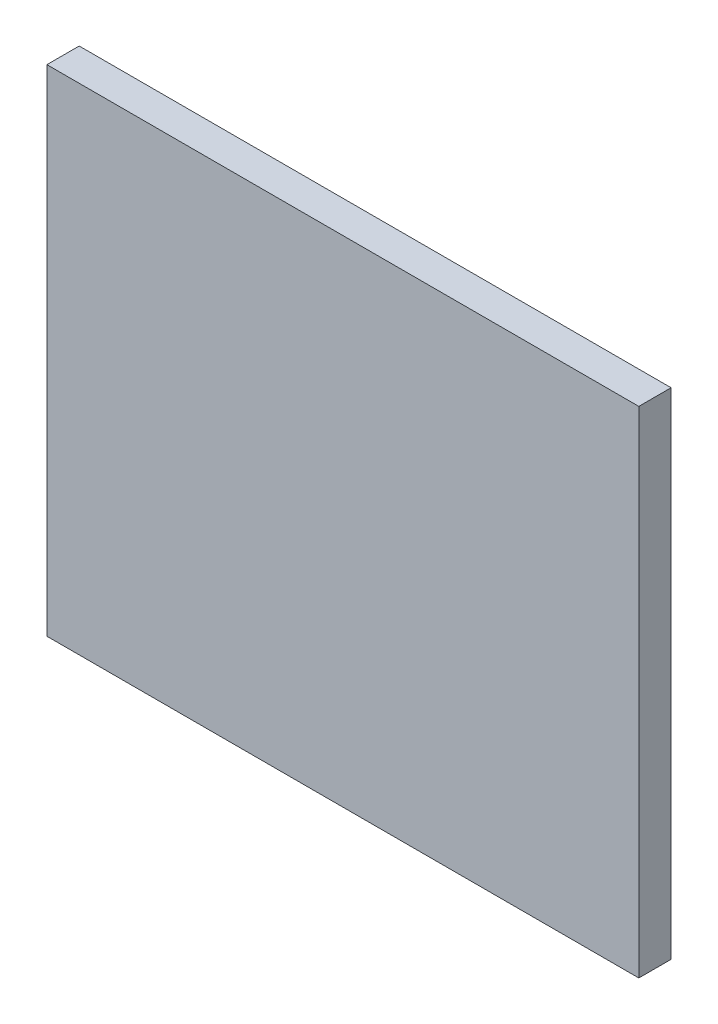
from build123d import *

# Parameters (mm, degrees)
SKETCH_1_W      = 55
SKETCH_1_H      = 46
EXTRUDE_1_DEPTH = 3
SKETCH_2_W      = 3
SKETCH_2_H      = 5
EXTRUDE_2_DEPTH = 2
CHAMFER_1_SIZE  = 2


with BuildPart() as part:
    # Эскиз1 → Бобышка-Вытянуть1 (new body)
    with BuildSketch(Plane.XY):
        with Locations((0, 20)):
            Rectangle(SKETCH_1_W, SKETCH_1_H)
    extrude(amount=EXTRUDE_1_DEPTH)

    # Эскиз2 → Бобышка-Вытянуть2 (add)
    with BuildSketch(Plane(origin=(0, 0, 0), x_dir=(-1, 0, 0), z_dir=(0, 0, -1))):
        with Locations((-22.6, 20)):
            Rectangle(SKETCH_2_W, SKETCH_2_H)
        with Locations((22.6, 20)):
            Rectangle(SKETCH_2_W, SKETCH_2_H)
    extrude(amount=EXTRUDE_2_DEPTH)

    # Фаска1
    chamfer_1_edges = [part.edges().sort_by_distance(p)[0] for p in [
        (-22.6, 17.5, 0),
        (-21.1, 20, 0),
        (-22.6, 22.5, 0),
        (22.6, 22.5, 0),
        (21.1, 20, 0),
        (22.6, 17.5, 0),
    ]]
    chamfer(chamfer_1_edges, length=CHAMFER_1_SIZE - 0.0001)  # a hair under: the kernel refuses the full size


solid = part.part
